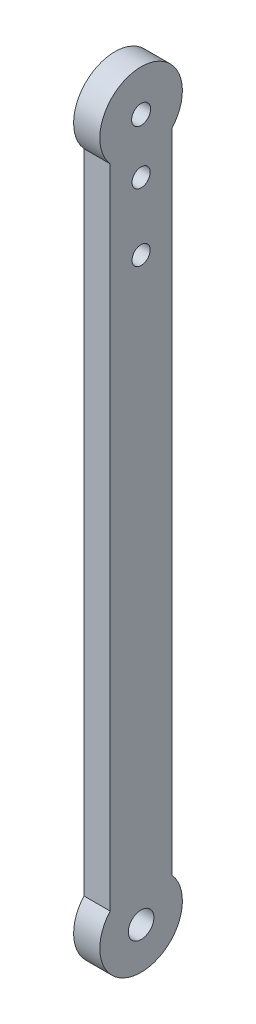
from build123d import *

# Parameters (mm, degrees)
SKETCH1_R           = 1.55
SKETCH1_R_2         = 1.1
SKETCH1_R_3         = 1.15
BOSS_EXTRUDE3_DEPTH = 3.175


with BuildPart() as part:
    # Sketch1 → Boss-Extrude3 (new body)
    with BuildSketch(Plane(origin=(0, 0, 0), x_dir=(0, 0, -1), z_dir=(1, 0, 0))):
        with BuildLine():
            Line((3.75, -3.307189139), (3.75, -81.692810861))
            ThreePointArc((3.75, -81.692810861), (0, -90), (-3.75, -81.692810861))
            Line((-3.75, -81.692810861), (-3.75, -3.307189139))
            ThreePointArc((-3.75, -3.307189139), (0, 5), (3.75, -3.307189139))
        make_face()
        with Locations((0, -85)):
            Circle(SKETCH1_R, mode=Mode.SUBTRACT)
        with Locations((0, -14.75)):
            Circle(SKETCH1_R_2, mode=Mode.SUBTRACT)
        Circle(SKETCH1_R_3, mode=Mode.SUBTRACT)
        with Locations((0, -6.6)):
            Circle(SKETCH1_R_2, mode=Mode.SUBTRACT)
    extrude(amount=BOSS_EXTRUDE3_DEPTH)


solid = part.part
